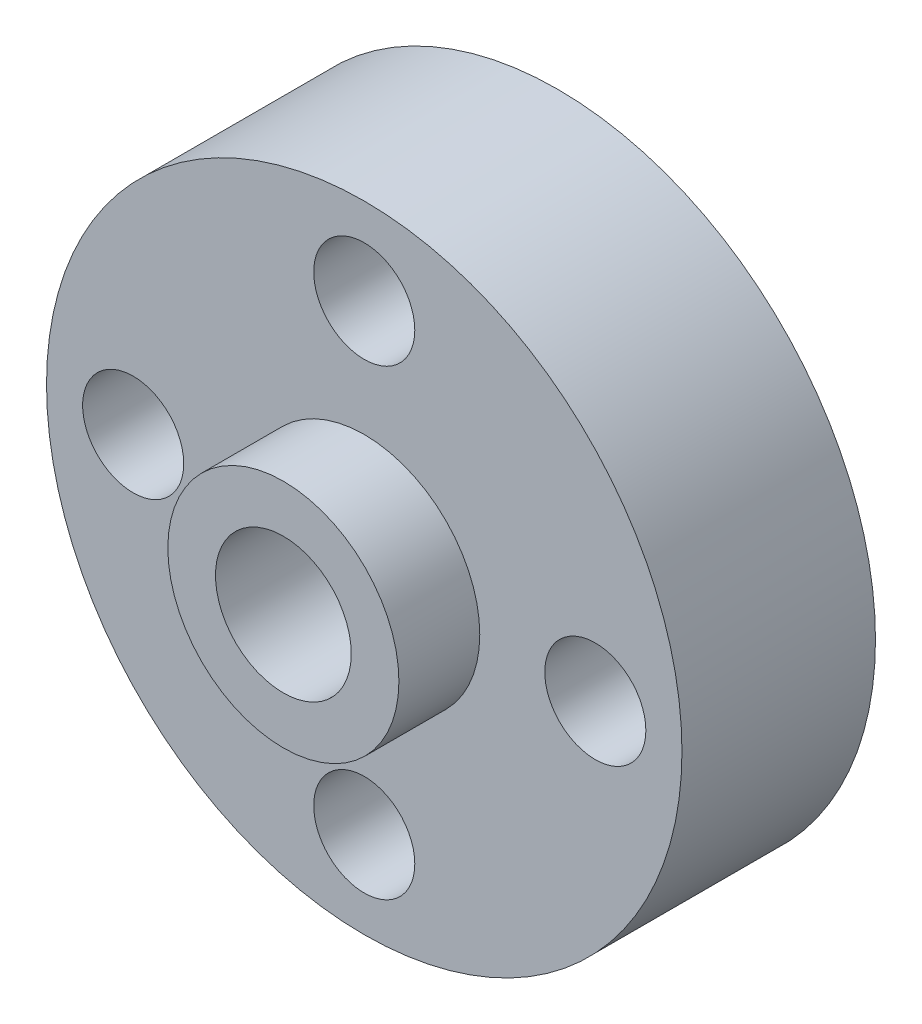
from build123d import *

# Parameters (mm, degrees)
SKETCH_1_R          = 11
SKETCH_1_R_2        = 1.75
EXTRUDE_1_DEPTH     = 6.7
SKETCH_2_R          = 4
SKETCH_2_R_2        = 2.35
EXTRUDE_2_DEPTH     = 2.8
SKETCH_2_2_R        = 2.35
CUT_EXTRUDE_1_DEPTH = 17.937827488


with BuildPart() as part:
    # 스케치1 → 보스-돌출1 (new body)
    with BuildSketch(Plane.XY):
        Circle(SKETCH_1_R)
        with Locations((0, 8)):
            Circle(SKETCH_1_R_2, mode=Mode.SUBTRACT)
        with Locations((8, 0)):
            Circle(SKETCH_1_R_2, mode=Mode.SUBTRACT)
        with Locations((0, -8)):
            Circle(SKETCH_1_R_2, mode=Mode.SUBTRACT)
        with Locations((-8, 0)):
            Circle(SKETCH_1_R_2, mode=Mode.SUBTRACT)
    extrude(amount=EXTRUDE_1_DEPTH)

    # 스케치2 → 보스-돌출2 (add)
    with BuildSketch(Plane.XY.offset(6.7)):
        Circle(SKETCH_2_R)
        Circle(SKETCH_2_R_2, mode=Mode.SUBTRACT)
    extrude(amount=EXTRUDE_2_DEPTH)

    # 스케치2<2> → 컷-돌출1 (cut, through all)
    with BuildSketch(Plane.XY.offset(6.7)):
        Circle(SKETCH_2_2_R)
    extrude(amount=-CUT_EXTRUDE_1_DEPTH, mode=Mode.SUBTRACT)


solid = part.part
